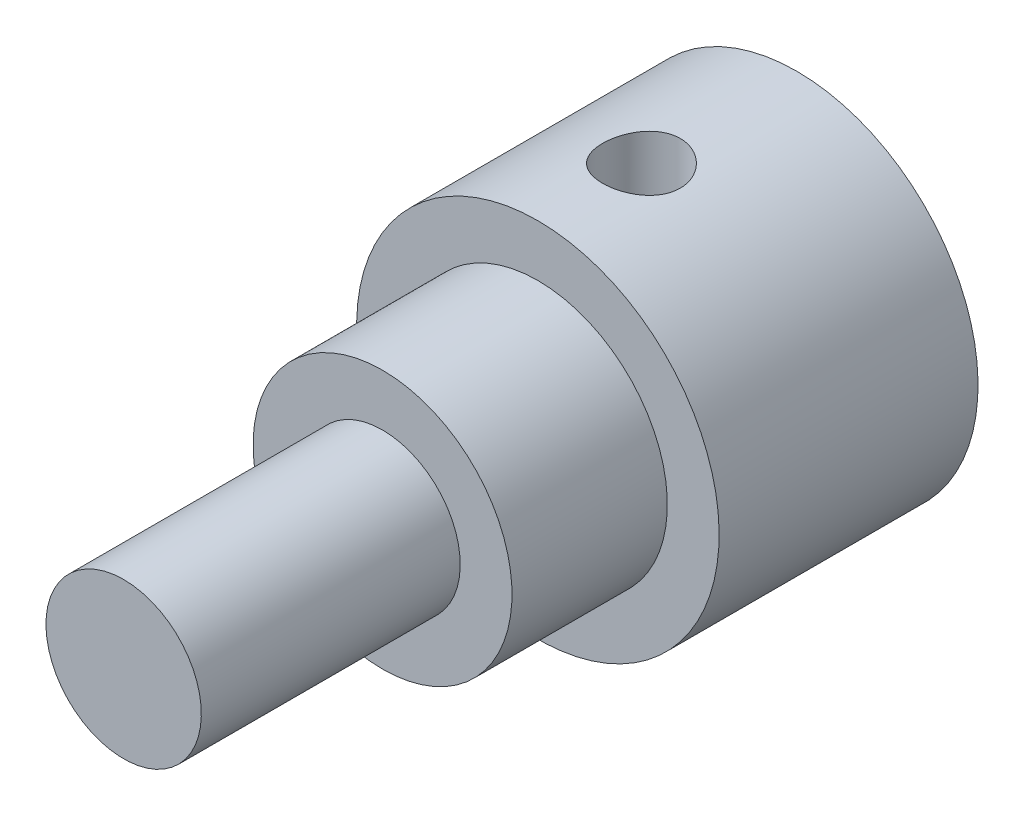
from build123d import *

# Parameters (mm, degrees)
CUT_EXTRUDE1_REACH             = 29.821
SKETCH2_R                      = 1.5
CUT_EXTRUDE1_DIRECTION_2_REACH = 29.821


with BuildPart() as part:
    # Sketch1 → Revolve1 (revolve)
    with BuildSketch(Plane(origin=(0, 0, 0), x_dir=(0, 0, -1), z_dir=(1, 0, 0))):
        Polygon((0, 0), (0, 3), (10, 3), (10, 5), (16, 5), (16, 7), (26, 7), (26, 3.2), (18.5, 3.2), (16.577246019, 0), align=None)
    revolve(axis=Axis((0, 0, -16.577246019), (0, 0, 1)))

    # Sketch2 → Cut-Extrude1 (cut, up to next)
    with BuildSketch(Plane(origin=(0, 0, 0), x_dir=(1, 0, 0), z_dir=(0, 1, 0)), mode=Mode.PRIVATE) as cut_extrude1_sk1:
        with Locations((0, 20)):
            Circle(SKETCH2_R)
    cut_extrude1_tool1 = extrude(cut_extrude1_sk1.sketch, amount=-CUT_EXTRUDE1_REACH, mode=Mode.PRIVATE) & part.part
    add(cut_extrude1_tool1.solids().sort_by_distance((0, 0, -20))[0], mode=Mode.SUBTRACT)

    # Sketch2 → Cut-Extrude1 direction 2 (cut, up to next)
    with BuildSketch(Plane(origin=(0, 0, 0), x_dir=(1, 0, 0), z_dir=(0, 1, 0)), mode=Mode.PRIVATE) as cut_extrude1_direction_2_sk1:
        with Locations((0, 20)):
            Circle(SKETCH2_R)
    cut_extrude1_direction_2_tool1 = extrude(cut_extrude1_direction_2_sk1.sketch, amount=CUT_EXTRUDE1_DIRECTION_2_REACH, mode=Mode.PRIVATE) & part.part
    add(cut_extrude1_direction_2_tool1.solids().sort_by_distance((0, 0, -20))[0], mode=Mode.SUBTRACT)


solid = part.part
